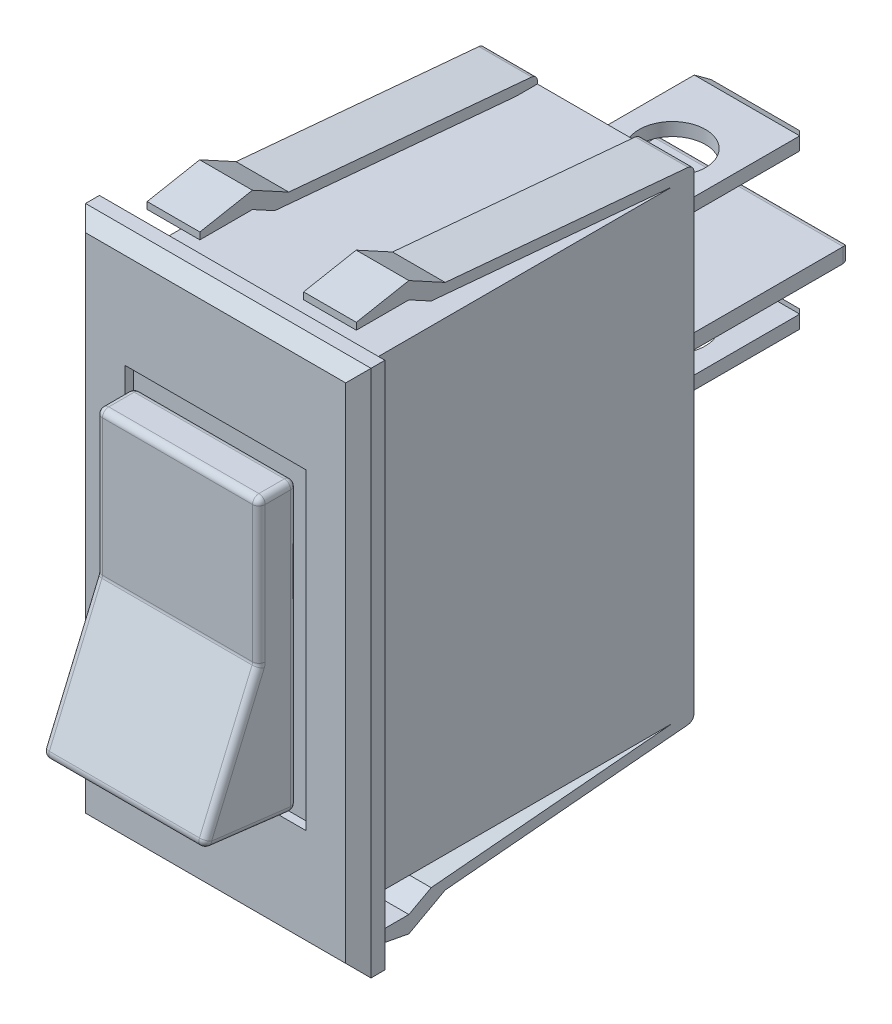
from build123d import *
from OCP.BRepFilletAPI import BRepFilletAPI_MakeChamfer

# Parameters (mm, degrees)
BOSS_EXTRUDE1_DEPTH  = 4.9022
SKETCH3_W            = 17.1958
SKETCH3_H            = 31.8008
BOSS_EXTRUDE2_DEPTH  = 1.6002
CHAMFER1_SIZE        = 0.762
SKETCH4_W            = 10.896044092
SKETCH4_H            = 18.816032884
CUT_EXTRUDE2_DEPTH   = 0.508
SKETCH5_W            = 12.5984
SKETCH5_H            = 27.9908
BOSS_EXTRUDE3_DEPTH  = 20.9042
SKETCH6_W            = 6.35
SKETCH6_H            = 0.7874
BOSS_EXTRUDE4_DEPTH  = 10.0076
CHAMFER2_SIZE        = 0.508
CHAMFER3_SIZE        = 0.508
CHAMFER3_SIZE2       = 0.23688429
SKETCH7_R            = 1.9939
CUT_EXTRUDE3_DEPTH   = 0.7874
LPATTERN1_COUNT      = 2
LPATTERN1_PITCH      = 9.2964
SKETCH9_W            = 11.324393704
SKETCH9_H            = 0.889
BOSS_EXTRUDE5_DEPTH  = 10.0076
FILLET1_R            = 0.381
BOSS_EXTRUDE6_DEPTH  = 3.175
FILLET2_R            = 0.381
FILLET2_OF_MIRROR3_R = 0.381
MIRROR4_START        = -6.2992
MIRROR4_DEPTH        = 3.175
MIRROR4_START_2      = 3.1242
MIRROR4_2_DEPTH      = 3.175
FILLET3_R            = 0.381


# Read off the part's stored shape, not the designer's step: Mirror4
with BuildPart() as part:
    # Sketch2 → Boss-Extrude1 (new, symmetric)
    with BuildSketch(Plane(origin=(0, 0, 0), x_dir=(0, 0, -1), z_dir=(1, 0, 0))):
        Polygon((-19.1008, -7.973972857), (-15.705952073, 0), (-15.705952073, 8.666558462), (-13.4112, 8.666558462), (-13.4112, -8.666558462), align=None)
    extrude(amount=BOSS_EXTRUDE1_DEPTH, both=True)

    # Sketch3 → Boss-Extrude2 (add)
    with BuildSketch(Plane(origin=(0, 0, 13.4112), x_dir=(-1, 0, 0), z_dir=(0, 0, -1))):
        Rectangle(SKETCH3_W, SKETCH3_H)
    extrude(amount=BOSS_EXTRUDE2_DEPTH)

    # Chamfer1
    chamfer1_edges = [part.edges().sort_by_distance(p)[0] for p in [
        (-8.5979, 0, 13.4112),
        (0, 15.9004, 13.4112),
        (8.5979, 0, 13.4112),
        (0, -15.9004, 13.4112),
    ]]
    chamfer(chamfer1_edges, length=CHAMFER1_SIZE)

    # Sketch4 → Cut-Extrude2 (cut)
    with BuildSketch(Plane.XY.offset(13.4112)):
        Rectangle(SKETCH4_W, SKETCH4_H)
    extrude(amount=-CUT_EXTRUDE2_DEPTH, mode=Mode.SUBTRACT)


with BuildPart() as cut_extrude2_piece_1:
    # of the separate pieces the step leaves, piece 1, a body of its own (cut_extrude2_pieces)
    add(part.part.solids().sort_by_distance((8.5979, 15.9004, 12.6492))[0])

    # Sketch5 → Boss-Extrude3 (add)
    with BuildSketch(Plane(origin=(0, 0, 11.811), x_dir=(-1, 0, 0), z_dir=(0, 0, -1))):
        Rectangle(SKETCH5_W, SKETCH5_H)
    extrude(amount=BOSS_EXTRUDE3_DEPTH)

    # Sketch9 → Boss-Extrude5 (add)
    with BuildSketch(Plane(origin=(0, 0, -9.0932), x_dir=(-1, 0, 0), z_dir=(0, 0, -1))):
        with Locations((0, 4.6482)):
            Rectangle(SKETCH9_W, SKETCH9_H)
    extrude(amount=BOSS_EXTRUDE5_DEPTH)

    # Fillet1
    fillet1_edges = [cut_extrude2_piece_1.edges().sort_by_distance(p)[0] for p in [
        (-5.662196852, 4.6482, -19.1008),
        (0, 5.0927, -19.1008),
        (5.662196852, 4.6482, -19.1008),
        (0, 4.2037, -19.1008),
    ]]
    fillet(fillet1_edges, radius=FILLET1_R)

    # Sketch11 → Boss-Extrude6 (add)
    with BuildSketch(Plane(origin=(6.2992, 0, 0), x_dir=(0, 0, -1), z_dir=(1, 0, 0))):
        Polygon((9.0932, 13.9954), (9.0932, 14.5034), (-5.880915867, 15.845854324), (-8.069641774, 17.036875135), (-11.233356301, 16.44136473), (-11.233356301, 16.028204475), (-8.069641774, 16.028204475), (-6.727879648, 15.298068915), (7.80245849, 13.9954), align=None)
    boss_extrude6 = extrude(amount=-BOSS_EXTRUDE6_DEPTH)

    # Fillet2
    fillet2_edges = [cut_extrude2_piece_1.edges().sort_by_distance(p)[0] for p in [
        (4.7117, 14.5034, -9.0932),
    ]]
    fillet(fillet2_edges, radius=FILLET2_R)

    # Mirror3: Boss-Extrude6 across plane
    add(boss_extrude6.mirror(Plane(origin=(0, 0, 0), x_dir=(0, 0, 1), z_dir=(1, 0, 0))))

    # Fillet2 of Mirror3
    fillet2_of_mirror3_edges = [cut_extrude2_piece_1.edges().sort_by_distance(p)[0] for p in [
        (-4.7117, 14.5034, -9.0932),
    ]]
    fillet(fillet2_of_mirror3_edges, radius=FILLET2_OF_MIRROR3_R)

    # Mirror4 outline → Mirror4 (add)
    with BuildSketch(Plane.YZ.offset(MIRROR4_START)):
        with BuildLine():
            Line((-16.028204475, 8.069641774), (-16.028204475, 11.233356301))
            Line((-16.028204475, 11.233356301), (-16.44136473, 11.233356301))
            Line((-16.44136473, 11.233356301), (-17.036875135, 8.069641774))
            Line((-17.036875135, 8.069641774), (-15.845854324, 5.880915867))
            Line((-15.845854324, 5.880915867), (-14.534507258, -8.746220836))
            ThreePointArc((-14.534507258, -8.746220836), (-14.412127508, -8.993378714), (-14.155029218, -9.0932))
            Line((-14.155029218, -9.0932), (-13.9954, -9.0932))
            Line((-13.9954, -9.0932), (-13.9954, -7.80245849))
            Line((-13.9954, -7.80245849), (-15.298068915, 6.727879648))
            Line((-15.298068915, 6.727879648), (-16.028204475, 8.069641774))
        make_face()
    extrude(amount=MIRROR4_DEPTH)

    # Mirror4 2 outline → Mirror4 2 (add)
    with BuildSketch(Plane.YZ.offset(MIRROR4_START_2)):
        with BuildLine():
            Line((-16.028204475, 8.069641774), (-16.028204475, 11.233356301))
            Line((-16.028204475, 11.233356301), (-16.44136473, 11.233356301))
            Line((-16.44136473, 11.233356301), (-17.036875135, 8.069641774))
            Line((-17.036875135, 8.069641774), (-15.845854324, 5.880915867))
            Line((-15.845854324, 5.880915867), (-14.534507258, -8.746220836))
            ThreePointArc((-14.534507258, -8.746220836), (-14.412127508, -8.993378714), (-14.155029218, -9.0932))
            Line((-14.155029218, -9.0932), (-13.9954, -9.0932))
            Line((-13.9954, -9.0932), (-13.9954, -7.80245849))
            Line((-13.9954, -7.80245849), (-15.298068915, 6.727879648))
            Line((-15.298068915, 6.727879648), (-16.028204475, 8.069641774))
        make_face()
    extrude(amount=MIRROR4_2_DEPTH)


with BuildPart() as cut_extrude2_piece_2:
    # of the separate pieces the step leaves, piece 2, a body of its own (cut_extrude2_pieces)
    add(part.part.solids().sort_by_distance((-4.9022, 8.666558462, 15.705952073))[0])

    # Fillet3
    fillet3_edges = [cut_extrude2_piece_2.edges().sort_by_distance(p)[0] for p in [
        (4.9022, 8.666558462, 14.558576037),
        (4.9022, 4.333279231, 15.705952073),
        (4.9022, -3.986986428, 17.403376037),
        (4.9022, -8.320265659, 16.256),
        (-4.9022, -3.986986428, 17.403376037),
        (-4.9022, 4.333279231, 15.705952073),
        (-4.9022, 8.666558462, 14.558576037),
        (-4.9022, 0, 13.4112),
        (-4.9022, -8.320265659, 16.256),
        (4.9022, 0, 13.4112),
        (0, -7.973972857, 19.1008),
        (0, 0, 15.705952073),
        (0, 8.666558462, 15.705952073),
        (0, 8.666558462, 13.4112),
        (0, -8.666558462, 13.4112),
    ]]
    fillet(fillet3_edges, radius=FILLET3_R)


with BuildPart() as body_3:
    # Sketch6 → Boss-Extrude4 (new body)
    with BuildSketch(Plane(origin=(0, 0, -9.0932), x_dir=(-1, 0, 0), z_dir=(0, 0, -1))):
        with Locations((0, 9.2964)):
            Rectangle(SKETCH6_W, SKETCH6_H)
    extrude(amount=BOSS_EXTRUDE4_DEPTH)

    # Chamfer2
    chamfer2_edges = [body_3.edges().sort_by_distance(p)[0] for p in [
        (3.175, 9.2964, -19.1008),
        (-3.175, 9.2964, -19.1008),
    ]]
    chamfer(chamfer2_edges, length=CHAMFER2_SIZE)

    # Chamfer3: one chamfer whose edges measure the first distance from different faces: ONE call of the kernel's chamfer builder (chamfer() names one face for all edges)
    chamfer3_edges_1 = [body_3.edges().sort_by_distance(p)[0] for p in [
        (0, 8.9027, -19.1008),
    ]]
    chamfer3_side_1 = [body_3.faces().sort_by_distance(p)[0] for p in [
        (0, 8.9027, -14.077287598),
    ]]
    chamfer3_edges_2 = [body_3.edges().sort_by_distance(p)[0] for p in [
        (0, 9.6901, -19.1008),
    ]]
    chamfer3_side_2 = [body_3.faces().sort_by_distance(p)[0] for p in [
        (0, 9.6901, -14.077287598),
    ]]
    chamfer3 = BRepFilletAPI_MakeChamfer(body_3.part.solid().wrapped)
    for e in chamfer3_edges_1:
        chamfer3.Add(CHAMFER3_SIZE, CHAMFER3_SIZE2, e.wrapped, chamfer3_side_1[0].wrapped)  # the first distance lies on this face
    for e in chamfer3_edges_2:
        chamfer3.Add(CHAMFER3_SIZE, CHAMFER3_SIZE2, e.wrapped, chamfer3_side_2[0].wrapped)  # the first distance lies on this face
    add(Compound.cast(chamfer3.Shape()), mode=Mode.REPLACE)

    # Sketch7 → Cut-Extrude3 (cut)
    with BuildSketch(Plane(origin=(0, 9.6901, 0), x_dir=(1, 0, 0), z_dir=(0, 1, 0))):
        with Locations(Location((0, 14.097, 0), (0, 0, 270))):
            Circle(SKETCH7_R)
    extrude(amount=-CUT_EXTRUDE3_DEPTH, mode=Mode.SUBTRACT)


with BuildPart() as lpattern1_1:
    # LPattern1: pattern copy
    add(body_3.part.moved(Location(Vector(0, -1, 0) * (1 * LPATTERN1_PITCH))))


solid = Compound([cut_extrude2_piece_1.part, cut_extrude2_piece_2.part, body_3.part, lpattern1_1.part])
